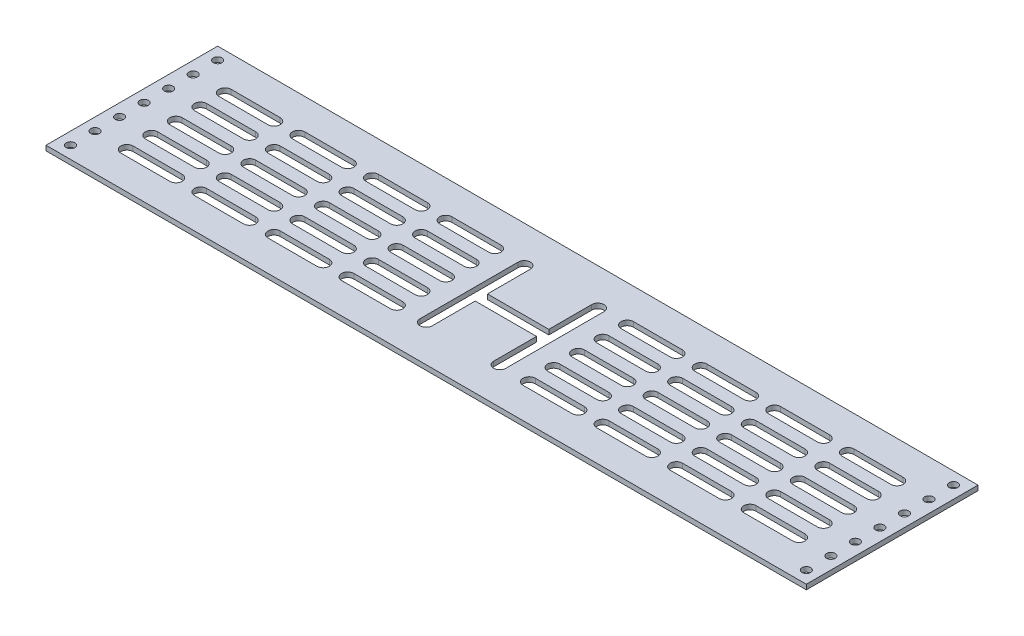
from build123d import *

# Parameters (mm, degrees)
EXTRUDE_1_DEPTH     = 2
SKETCH_2_R          = 1.75
CUT_EXTRUDE_1_DEPTH = 175.439101121
CUT_EXTRUDE_3_DEPTH = 10
CUT_EXTRUDE_4_DEPTH = 10


with BuildPart() as part:
    # 草图1 → 凸台-拉伸1 (new body)
    with BuildSketch(Plane(origin=(0, 0, 0), x_dir=(1, 0, 0), z_dir=(0, 1, 0))):
        Polygon((0, 0), (-155, 0), (-155, -80), (155, -80), (155, 0), align=None)
    extrude(amount=EXTRUDE_1_DEPTH)

    # 草图2 → 切除-拉伸1 (cut, through all)
    with BuildSketch(Plane(origin=(0, 2, 0), x_dir=(1, 0, 0), z_dir=(0, 1, 0))):
        with Locations((-150, -75)):
            Circle(SKETCH_2_R)
        with Locations((-150, -5)):
            Circle(SKETCH_2_R)
        with Locations((-150, -15)):
            Circle(SKETCH_2_R)
        with Locations((-150, -25)):
            Circle(SKETCH_2_R)
        with Locations((-150, -35)):
            Circle(SKETCH_2_R)
        with Locations((-150, -45)):
            Circle(SKETCH_2_R)
        with Locations((-150, -55)):
            Circle(SKETCH_2_R)
        with Locations((-150, -65)):
            Circle(SKETCH_2_R)
        with Locations((150, -5)):
            Circle(SKETCH_2_R)
        with Locations((150, -15)):
            Circle(SKETCH_2_R)
        with Locations((150, -25)):
            Circle(SKETCH_2_R)
        with Locations((150, -35)):
            Circle(SKETCH_2_R)
        with Locations((150, -45)):
            Circle(SKETCH_2_R)
        with Locations((150, -55)):
            Circle(SKETCH_2_R)
        with Locations((150, -65)):
            Circle(SKETCH_2_R)
        with Locations((150, -75)):
            Circle(SKETCH_2_R)
    extrude(amount=-CUT_EXTRUDE_1_DEPTH, mode=Mode.SUBTRACT)

    # 草图4 → 切除-拉伸3 (cut)
    with BuildSketch(Plane.XZ):
        Polygon((168.616628746, 10), (150, 10), (-155, 10), (-155, 0), (155, 0), align=None)
    extrude(amount=-CUT_EXTRUDE_3_DEPTH, mode=Mode.SUBTRACT)

    # 草图3 → 切除-拉伸4 (cut)
    with BuildSketch(Plane(origin=(0, 2, 0), x_dir=(1, 0, 0), z_dir=(0, 1, 0))):
        with BuildLine():
            Line((-12.5, -47.5), (0, -47.5))
            Line((0, -47.5), (12.5, -47.5))
            Line((12.5, -47.5), (12.5, -65))
            ThreePointArc((12.5, -65), (15, -67.5), (17.5, -65))
            Line((17.5, -65), (17.5, -25))
            ThreePointArc((17.5, -25), (15, -22.5), (12.5, -25))
            Line((12.5, -25), (12.5, -42.5))
            Line((12.5, -42.5), (-12.5, -42.5))
            Line((-12.5, -42.5), (-12.5, -25))
            ThreePointArc((-12.5, -25), (-15, -22.500000146), (-17.5, -25))
            Line((-17.5, -25), (-17.5, -65))
            ThreePointArc((-17.5, -65), (-15, -67.5), (-12.5, -65))
            Line((-12.5, -65), (-12.5, -47.5))
        make_face()
        with BuildLine():
            ThreePointArc((-117, -67.5), (-114.5, -65), (-117, -62.5))
            Line((-117, -62.5), (-137, -62.5))
            ThreePointArc((-137, -62.5), (-139.5, -65), (-137, -67.5))
            Line((-137, -67.5), (-117, -67.5))
        make_face()
        with BuildLine():
            ThreePointArc((-87, -67.5), (-84.5, -65), (-87, -62.5))
            Line((-87, -62.5), (-107, -62.5))
            ThreePointArc((-107, -62.5), (-109.5, -65), (-107, -67.5))
            Line((-107, -67.5), (-87, -67.5))
        make_face()
        with BuildLine():
            ThreePointArc((-117, -27.5), (-114.5, -25), (-117, -22.5))
            Line((-117, -22.5), (-137, -22.5))
            ThreePointArc((-137, -22.5), (-139.5, -25), (-137, -27.5))
            Line((-137, -27.5), (-117, -27.5))
        make_face()
        with BuildLine():
            ThreePointArc((-87, -27.5), (-84.5, -25), (-87, -22.5))
            Line((-87, -22.5), (-107, -22.5))
            ThreePointArc((-107, -22.5), (-109.5, -25), (-107, -27.5))
            Line((-107, -27.5), (-87, -27.5))
        make_face()
        with BuildLine():
            ThreePointArc((-47, -22.5), (-48.767766953, -23.232233047), (-49.5, -25))
            ThreePointArc((-49.5, -25), (-48.767766953, -26.767766953), (-47, -27.5))
            Line((-47, -27.5), (-27, -27.5))
            ThreePointArc((-27, -27.5), (-24.5, -25), (-27, -22.5))
            Line((-27, -22.5), (-47, -22.5))
        make_face()
        with BuildLine():
            Line((-77, -27.5), (-57, -27.5))
            ThreePointArc((-57, -27.5), (-54.5, -25), (-57, -22.5))
            Line((-57, -22.5), (-77, -22.5))
            ThreePointArc((-77, -22.5), (-79.5, -25), (-77, -27.5))
        make_face()
        with BuildLine():
            Line((-77, -37.5), (-57, -37.5))
            ThreePointArc((-57, -37.5), (-54.5, -35), (-57, -32.5))
            Line((-57, -32.5), (-77, -32.5))
            ThreePointArc((-77, -32.5), (-79.5, -35), (-77, -37.5))
        make_face()
        with BuildLine():
            Line((-77, -47.5), (-57, -47.5))
            ThreePointArc((-57, -47.5), (-54.5, -45), (-57, -42.5))
            Line((-57, -42.5), (-77, -42.5))
            ThreePointArc((-77, -42.5), (-79.5, -45), (-77, -47.5))
        make_face()
        with BuildLine():
            Line((-77, -57.5), (-57, -57.5))
            ThreePointArc((-57, -57.5), (-54.5, -55), (-57, -52.5))
            Line((-57, -52.5), (-77, -52.5))
            ThreePointArc((-77, -52.5), (-79.5, -55), (-77, -57.5))
        make_face()
        with BuildLine():
            ThreePointArc((-47, -62.5), (-48.767766953, -63.232233047), (-49.5, -65))
            ThreePointArc((-49.5, -65), (-48.767766953, -66.767766953), (-47, -67.5))
            Line((-47, -67.5), (-27, -67.5))
            ThreePointArc((-27, -67.5), (-24.5, -65), (-27, -62.5))
            Line((-27, -62.5), (-47, -62.5))
        make_face()
        with BuildLine():
            Line((-77, -67.5), (-57, -67.5))
            ThreePointArc((-57, -67.5), (-54.5, -65), (-57, -62.5))
            Line((-57, -62.5), (-77, -62.5))
            ThreePointArc((-77, -62.5), (-79.5, -65), (-77, -67.5))
        make_face()
        with BuildLine():
            ThreePointArc((-137, -52.5), (-139.5, -55), (-137, -57.5))
            Line((-137, -57.5), (-117, -57.5))
            ThreePointArc((-117, -57.5), (-114.5, -55), (-117, -52.5))
            Line((-117, -52.5), (-137, -52.5))
        make_face()
        with BuildLine():
            ThreePointArc((-107, -52.5), (-109.5, -55), (-107, -57.5))
            Line((-107, -57.5), (-87, -57.5))
            ThreePointArc((-87, -57.5), (-84.5, -55), (-87, -52.5))
            Line((-87, -52.5), (-107, -52.5))
        make_face()
        with BuildLine():
            ThreePointArc((-137, -42.5), (-139.5, -45), (-137, -47.5))
            Line((-137, -47.5), (-117, -47.5))
            ThreePointArc((-117, -47.5), (-114.5, -45), (-117, -42.5))
            Line((-117, -42.5), (-137, -42.5))
        make_face()
        with BuildLine():
            ThreePointArc((-107, -42.5), (-109.5, -45), (-107, -47.5))
            Line((-107, -47.5), (-87, -47.5))
            ThreePointArc((-87, -47.5), (-84.5, -45), (-87, -42.5))
            Line((-87, -42.5), (-107, -42.5))
        make_face()
        with BuildLine():
            ThreePointArc((-137, -32.5), (-139.5, -35), (-137, -37.5))
            Line((-137, -37.5), (-117, -37.5))
            ThreePointArc((-117, -37.5), (-114.5, -35), (-117, -32.5))
            Line((-117, -32.5), (-137, -32.5))
        make_face()
        with BuildLine():
            ThreePointArc((-107, -32.5), (-109.5, -35), (-107, -37.5))
            Line((-107, -37.5), (-87, -37.5))
            ThreePointArc((-87, -37.5), (-84.5, -35), (-87, -32.5))
            Line((-87, -32.5), (-107, -32.5))
        make_face()
        with BuildLine():
            ThreePointArc((-47, -52.5), (-49.5, -55), (-47, -57.5))
            Line((-47, -57.5), (-27, -57.5))
            ThreePointArc((-27, -57.5), (-24.5, -55), (-27, -52.5))
            Line((-27, -52.5), (-47, -52.5))
        make_face()
        with BuildLine():
            ThreePointArc((-47, -42.5), (-49.5, -45), (-47, -47.5))
            Line((-47, -47.5), (-27, -47.5))
            ThreePointArc((-27, -47.5), (-24.5, -45), (-27, -42.5))
            Line((-27, -42.5), (-47, -42.5))
        make_face()
        with BuildLine():
            ThreePointArc((-47, -32.5), (-49.5, -35), (-47, -37.5))
            Line((-47, -37.5), (-27, -37.5))
            ThreePointArc((-27, -37.5), (-24.5, -35), (-27, -32.5))
            Line((-27, -32.5), (-47, -32.5))
        make_face()
    cut_extrude_4 = extrude(amount=-CUT_EXTRUDE_4_DEPTH, mode=Mode.SUBTRACT)

    # 镜向1: 切除-拉伸4 across plane
    add(cut_extrude_4.mirror(Plane(origin=(0, 0, 0), x_dir=(0, 0, 1), z_dir=(1, 0, 0))), mode=Mode.SUBTRACT)


solid = part.part
